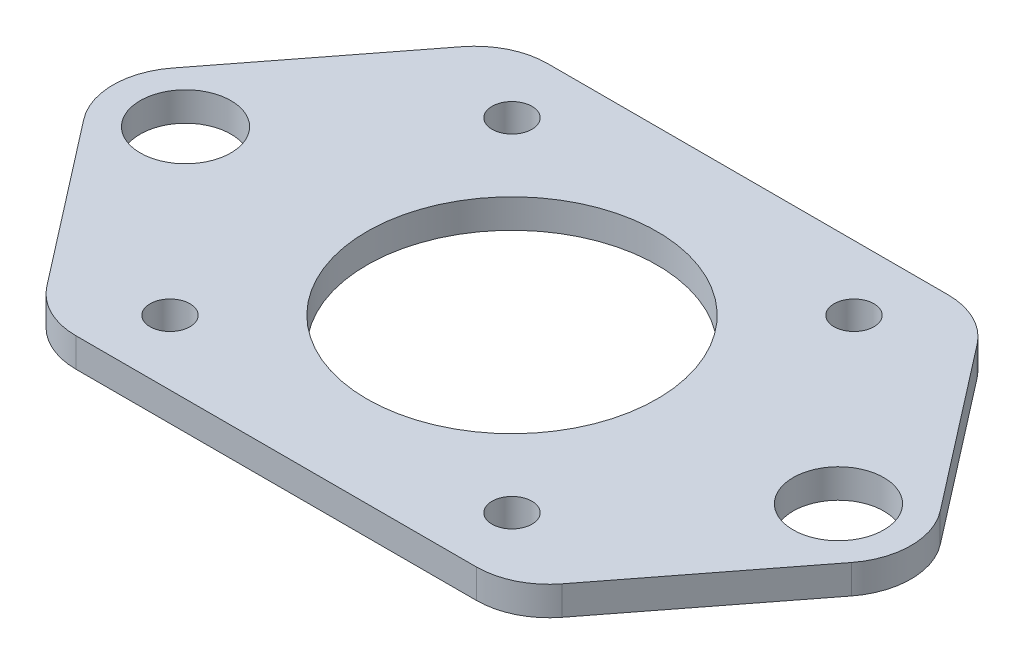
from build123d import *

# Parameters (mm, degrees)
SKETCH1_R          = 20
SKETCH1_R_2        = 2.75
SKETCH1_R_3        = 6.25
BASE_FLANGE1_DEPTH = 4
FILLET1_R          = 10


# Sheet-metal steps are written as plain solids
with BuildPart() as part:
    # Sketch1 → Base-Flange1 (new body)
    with BuildSketch(Plane(origin=(0, 0, 0), x_dir=(1, 0, 0), z_dir=(0, 1, 0))):
        with BuildLine():
            Line((32.5, 32.5), (52.909362517, 6.118985584))
            ThreePointArc((52.909362517, 6.118985584), (55, 0), (52.909362517, -6.118985584))
            Line((52.909362517, -6.118985584), (32.5, -32.5))
            Line((32.5, -32.5), (-32.5, -32.5))
            Line((-32.5, -32.5), (-52.909362517, -6.118985584))
            ThreePointArc((-52.909362517, -6.118985584), (-55, 0), (-52.909362517, 6.118985584))
            Line((-52.909362517, 6.118985584), (-32.5, 32.5))
            Line((-32.5, 32.5), (32.5, 32.5))
        make_face()
        with Locations(Location((0, 0, 0), (0, 0, 270))):
            Circle(SKETCH1_R, mode=Mode.SUBTRACT)
        with Locations(Location((-23.57, 23.57, 0), (0, 0, 270))):
            Circle(SKETCH1_R_2, mode=Mode.SUBTRACT)
        with Locations(Location((23.57, 23.57, 0), (0, 0, 270))):
            Circle(SKETCH1_R_2, mode=Mode.SUBTRACT)
        with Locations(Location((23.57, -23.57, 0), (0, 0, 270))):
            Circle(SKETCH1_R_2, mode=Mode.SUBTRACT)
        with Locations(Location((-23.57, -23.57, 0), (0, 0, 270))):
            Circle(SKETCH1_R_2, mode=Mode.SUBTRACT)
        with Locations(Location((-45, 0, 0), (0, 0, 270))):
            Circle(SKETCH1_R_3, mode=Mode.SUBTRACT)
        with Locations(Location((45, 0, 0), (0, 0, 270))):
            Circle(SKETCH1_R_3, mode=Mode.SUBTRACT)
    extrude(amount=-BASE_FLANGE1_DEPTH)

    # Fillet1
    fillet1_edges = [part.edges().sort_by_distance(p)[0] for p in [
        (32.5, -2, -32.5),
        (32.5, -2, 32.5),
        (-32.5, -2, 32.5),
        (-32.5, -2, -32.5),
    ]]
    fillet(fillet1_edges, radius=FILLET1_R)


solid = part.part
